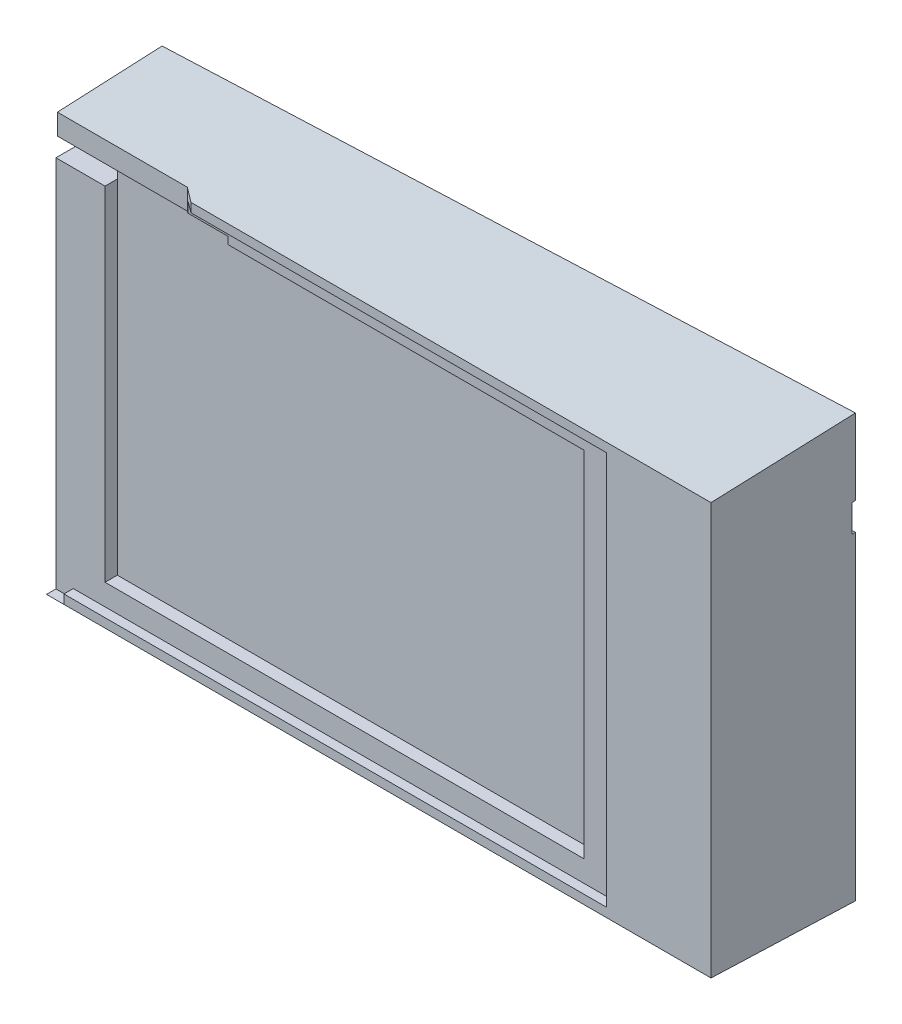
from build123d import *

# Parameters (mm, degrees)
FILM_PLANE_DEPTH        = 3
CUT_EXTRUDE2_DEPTH      = 1.3
NOTCH_W                 = 6.8
NOTCH_H                 = 2.5
NOTCH_CUT_DEPTH         = 4.1
SKETCH10_W              = 6.297854397
SKETCH10_H              = 3.8
CUT_EXTRUDE4_DEPTH      = 0.5
CUT_EXTRUDE5_DEPTH      = 1.5
CUT_EXTRUDE6_DEPTH      = 111.449366381
CUT_EXTRUDE6_DEPTH_BACK = 5


with BuildPart() as part:
    # Sketch3 → body section 0
    with BuildSketch(Plane(origin=(0, 0, 0), x_dir=(0, 0, -1), z_dir=(1, 0, 0))):
        with BuildLine():
            Line((0, 61), (16, 61.75))
            Line((16, 61.75), (16, 3.25))
            Line((16, 3.25), (0, 4))
            Line((0, 4), (0, 61))
        make_face()
    # Sketch2 → body section 1
    with BuildSketch(Plane(origin=(92, 0, 0), x_dir=(0, 0, -1), z_dir=(1, 0, 0))):
        with BuildLine():
            Line((0, 61), (20, 61.75))
            Line((20, 61.75), (20, 3.25))
            Line((20, 3.25), (0, 4))
            Line((0, 4), (0, 61))
        make_face()
    loft()

    # Sketch6 → film plane (cut)
    with BuildSketch(Plane.XY):
        Polygon((6.8, 58.2), (6.8, 8.2), (73.1, 8.2), (73.1, 57.2), (23.8, 57.2), (23.8, 58.2), align=None)
    extrude(amount=-FILM_PLANE_DEPTH, mode=Mode.SUBTRACT)

    # Sketch7 → Cut-Extrude2 (cut)
    with BuildSketch(Plane.XY):
        Polygon((77.5, 5.25), (77.5, 59.75), (0, 59.75), (0, 4), (2.4, 4), (2.4, 5.25), align=None)
    extrude(amount=-CUT_EXTRUDE2_DEPTH, mode=Mode.SUBTRACT)

    # notch → notch-cut (cut)
    with BuildSketch(Plane.XY.offset(-1.3)):
        with Locations((3.4, 56.95)):
            Rectangle(NOTCH_W, NOTCH_H)
    extrude(amount=-NOTCH_CUT_DEPTH, mode=Mode.SUBTRACT)

    # Sketch10 → Cut-Extrude4 (cut)
    with BuildSketch(Plane(origin=(-0.694339623, 0, -15.969811321), x_dir=(-0.9990561583550596, 0, 0.04343722427630701), z_dir=(-0.043437224276307015, 0, -0.9990561583550597))):
        with Locations((-89.632983856, 49.35)):
            Rectangle(SKETCH10_W, SKETCH10_H)
    extrude(amount=-CUT_EXTRUDE4_DEPTH, mode=Mode.SUBTRACT)

    # Sketch11 → Cut-Extrude5 (cut)
    with BuildSketch(Plane(origin=(-0.694339623, 0, -15.969811321), x_dir=(-0.9990561583550596, 0, 0.04343722427630701), z_dir=(-0.043437224276307015, 0, -0.9990561583550597))):
        with BuildLine():
            Line((-72.5, 14.5), (-64, 14.5))
            ThreePointArc((-64, 14.5), (-62.232233047, 15.232233047), (-61.5, 17))
            Line((-61.5, 17), (-61.5, 48))
            ThreePointArc((-61.5, 48), (-62.232233047, 49.767766953), (-64, 50.5))
            Line((-64, 50.5), (-72.5, 50.5))
            ThreePointArc((-72.5, 50.5), (-74.267766953, 49.767766953), (-75, 48))
            Line((-75, 48), (-75, 17))
            ThreePointArc((-75, 17), (-74.267766953, 15.232233047), (-72.5, 14.5))
        make_face()
        with BuildLine():
            Line((-24.5, 14.5), (-16, 14.5))
            ThreePointArc((-16, 14.5), (-14.232233047, 15.232233047), (-13.5, 17))
            Line((-13.5, 17), (-13.5, 48))
            ThreePointArc((-13.5, 48), (-14.232233047, 49.767766953), (-16, 50.5))
            Line((-16, 50.5), (-24.5, 50.5))
            ThreePointArc((-24.5, 50.5), (-26.267766953, 49.767766953), (-27, 48))
            Line((-27, 48), (-27, 17))
            ThreePointArc((-27, 17), (-26.267766953, 15.232233047), (-24.5, 14.5))
        make_face()
    extrude(amount=-CUT_EXTRUDE5_DEPTH, mode=Mode.SUBTRACT)

    # Sketch5 → Cut-Extrude6 (cut, two sides: drawn at the far end of the back side and taken through both)
    with BuildSketch(Plane(origin=(0, 61, 0), x_dir=(1, 0, 0), z_dir=(0, 1, 0)).offset(-CUT_EXTRUDE6_DEPTH_BACK)):
        Polygon((0, 1.5), (18, 1.5), (20, 0), (0, 0), align=None)
    extrude(amount=CUT_EXTRUDE6_DEPTH + CUT_EXTRUDE6_DEPTH_BACK, mode=Mode.SUBTRACT)


solid = part.part
